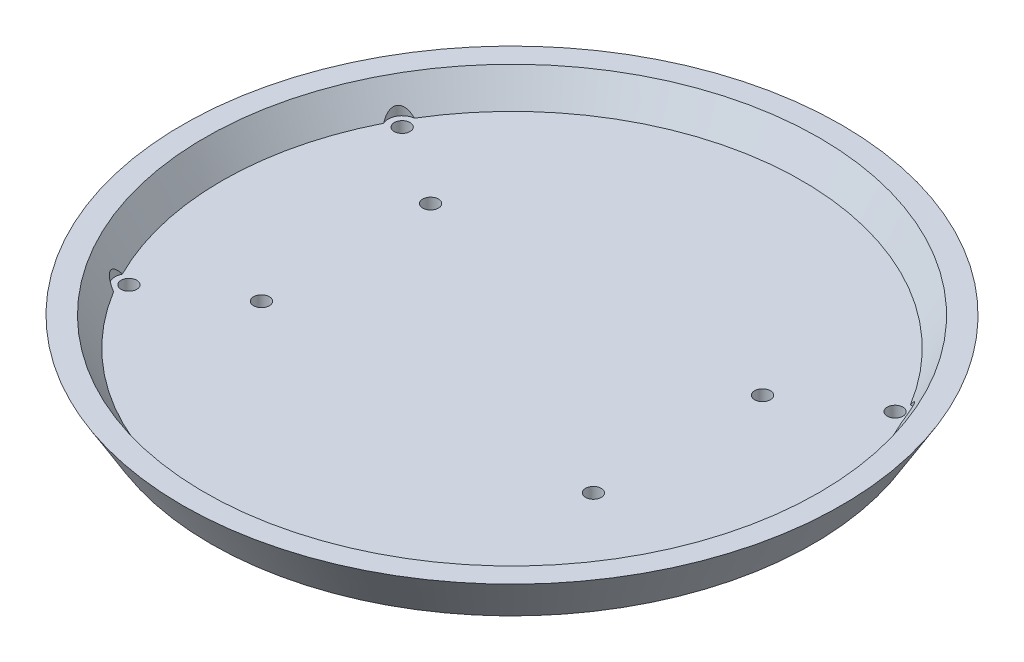
from build123d import *

# Parameters (mm, degrees)
SKETCH4_R          = 1.65
CUT_EXTRUDE1_DEPTH = 98.765024421
SKETCH5_R          = 2.9
CUT_EXTRUDE2_DEPTH = 98.765024421


with BuildPart() as part:
    # Sketch1 → Revolve1 (revolve)
    with BuildSketch(Plane.XY):
        Polygon((0, -4), (63, -4), (69, 6), (64.335238484, 6), (60.735238484, 0), (0, 0), align=None)
    revolve(axis=Axis((0, -4, 0), (0, 1, 0)))

    # Sketch4 → Cut-Extrude1 (cut, through all)
    with BuildSketch(Plane(origin=(0, 0, 0), x_dir=(1, 0, 0), z_dir=(0, 1, 0))):
        with Locations((34.749254443, 17.70562949)):
            Circle(SKETCH4_R)
        with Locations((51.602562721, 28.603767595)):
            Circle(SKETCH4_R)
        with Locations((51.602562721, -28.603767595)):
            Circle(SKETCH4_R)
        with Locations((34.749254443, -17.70562949)):
            Circle(SKETCH4_R)
        with Locations((-34.749254443, -17.70562949)):
            Circle(SKETCH4_R)
        with Locations((-51.602562721, -28.603767595)):
            Circle(SKETCH4_R)
        with Locations((-51.602562721, 28.603767595)):
            Circle(SKETCH4_R)
        with Locations((-34.749254443, 17.70562949)):
            Circle(SKETCH4_R)
    extrude(amount=-CUT_EXTRUDE1_DEPTH, mode=Mode.SUBTRACT)

    # Sketch5 → Cut-Extrude2 (cut, through all)
    with BuildSketch(Plane(origin=(0, 0, 0), x_dir=(1, 0, 0), z_dir=(0, 1, 0))):
        with Locations((51.602562721, 28.603767595)):
            Circle(SKETCH5_R)
        with Locations((51.602562721, -28.603767595)):
            Circle(SKETCH5_R)
        with Locations((-51.602562721, -28.603767595)):
            Circle(SKETCH5_R)
        with Locations((-51.602562721, 28.603767595)):
            Circle(SKETCH5_R)
    extrude(amount=CUT_EXTRUDE2_DEPTH, mode=Mode.SUBTRACT)


solid = part.part
